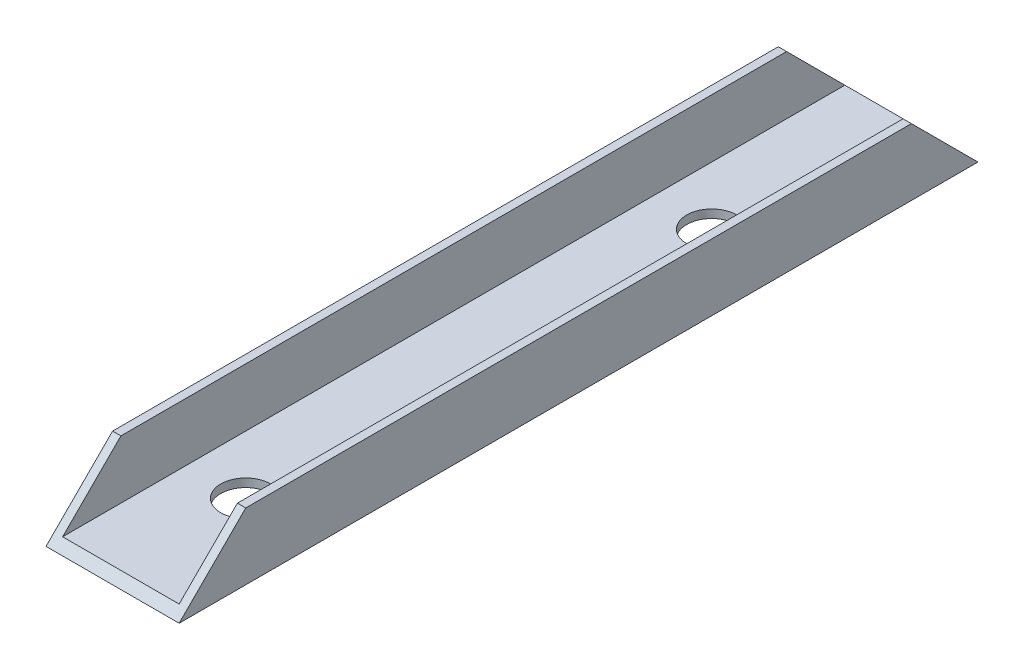
from build123d import *

# Parameters (mm, degrees)
BOSS_EXTRUDE1_DEPTH = 304.8
CUT_EXTRUDE1_DEPTH  = 311.04651264
SKETCH3_R           = 9.525
CUT_EXTRUDE2_DEPTH  = 330.2


with BuildPart() as part:
    # Sketch1 → Boss-Extrude1 (new body)
    with BuildSketch(Plane.XY):
        Polygon((-25.4, 0), (25.4, 0), (25.4, 25.4), (22.225, 25.4), (22.225, 3.175), (-22.225, 3.175), (-22.225, 25.4), (-25.4, 25.4), align=None)
    extrude(amount=BOSS_EXTRUDE1_DEPTH)

    # Sketch2 → Cut-Extrude1 (cut, through all)
    with BuildSketch(Plane(origin=(25.4, 0, 0), x_dir=(0, 0, -1), z_dir=(1, 0, 0))):
        Polygon((-304.8, 0), (-279.4, 25.4), (-304.8, 25.4), align=None)
        Polygon((0, 0), (0, 25.4), (-25.4, 25.4), align=None)
    extrude(amount=-CUT_EXTRUDE1_DEPTH, mode=Mode.SUBTRACT)

    # Sketch3 → Cut-Extrude2 (cut)
    with BuildSketch(Plane.XZ):
        with Locations((0, 254)):
            Circle(SKETCH3_R)
        with Locations((0, 76.2)):
            Circle(SKETCH3_R)
    extrude(amount=-CUT_EXTRUDE2_DEPTH, mode=Mode.SUBTRACT)


solid = part.part
